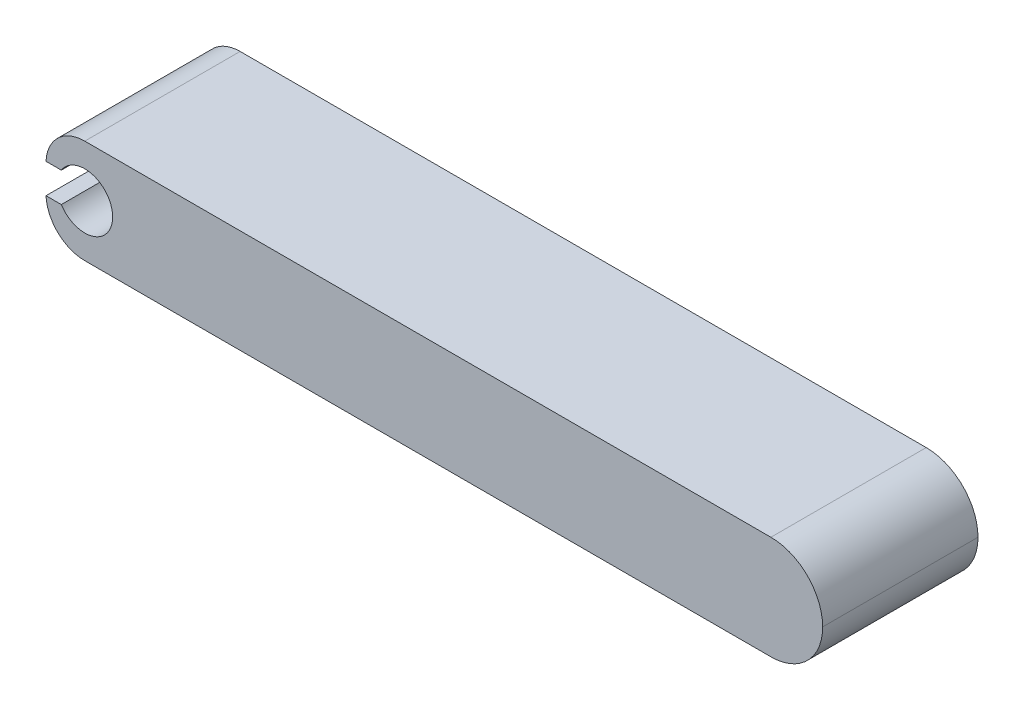
from build123d import *

# Parameters (mm, degrees)
ESQUISSE1_W                  = 60
ESQUISSE1_H                  = 8
BOSS_EXTRU_1_DEPTH           = 12
ENL_V_MAT_EXTRU_1_DEPTH      = 62.708994482
ENL_V_MAT_EXTRU_1_DEPTH_BACK = 62.708994482
ESQUISSE2_R                  = 2.15
ENL_V_MAT_EXTRU_2_DEPTH      = 62.708994482
ENL_V_MAT_EXTRU_2_DEPTH_BACK = 62.708994482
ESQUISSE3_W                  = 2
ESQUISSE3_H                  = 2.3
CONG_1_R                     = 4
CONG_2_R                     = 3


# Some blends are built 0.0001 mm under size
with BuildPart() as part:
    # Esquisse1 → Boss.-Extru.1 (new body)
    with BuildSketch(Plane.XY):
        with Locations((30, 4)):
            Rectangle(ESQUISSE1_W, ESQUISSE1_H)
    extrude(amount=BOSS_EXTRU_1_DEPTH)

    # Esquisse2 → Enlèv. mat.-Extru.1 (cut, two sides: drawn at the far end of the back side and taken through both)
    with BuildSketch(Plane.XY.offset(12).offset(-ENL_V_MAT_EXTRU_1_DEPTH_BACK)):
        with Locations((3, 4)):
            Circle(ESQUISSE2_R)
    extrude(amount=ENL_V_MAT_EXTRU_1_DEPTH + ENL_V_MAT_EXTRU_1_DEPTH_BACK, mode=Mode.SUBTRACT)

    # Esquisse3 → Enlèv. mat.-Extru.2 (cut, two sides: drawn at the far end of the back side and taken through both)
    with BuildSketch(Plane.XY.offset(12).offset(-ENL_V_MAT_EXTRU_2_DEPTH_BACK)):
        with Locations((1, 4)):
            Rectangle(ESQUISSE3_W, ESQUISSE3_H)
    extrude(amount=ENL_V_MAT_EXTRU_2_DEPTH + ENL_V_MAT_EXTRU_2_DEPTH_BACK, mode=Mode.SUBTRACT)

    # Congé1
    cong_1_edges = [part.edges().sort_by_distance(p)[0] for p in [
        (60, 0, 6),
        (60, 8, 6),
    ]]
    fillet(cong_1_edges, radius=CONG_1_R - 0.0001)  # a hair under: the kernel refuses the full size

    # Congé2
    # the kernel refuses this fillet: 3 mm, written as the material it takes off along each edge
    with BuildSketch(Plane(origin=(0, 0, -7.490619133), x_dir=(1, 0, 0), z_dir=(0, 0, 1))) as cong_2_piece_1:
        with BuildLine():
            CenterArc((2.996247653, 3), CONG_2_R, 182.865983983, 87.134016017)
            Line((0, 2.85), (-0.059924953, 2.847))
            ThreePointArc((-0.059924953, 2.847), (-0.06, 1.425), (-0.06, 0))
            Line((-0.06, 0), (0, -0.06))
            Line((0, -0.06), (2.996247653, -0.06))
            Line((2.996247653, -0.06), (2.996247653, 0))
        make_face()
    extrude(amount=26.981238267, mode=Mode.SUBTRACT)
    with BuildSketch(Plane(origin=(0, 8, -7.490619133), x_dir=(1, 0, 0), z_dir=(0, 0, 1))) as cong_2_piece_2:
        with BuildLine():
            CenterArc((2.996247653, -3), CONG_2_R, 90, 87.134016017)
            Line((0, -2.85), (-0.059924953, -2.847))
            ThreePointArc((-0.059924953, -2.847), (-0.06, -1.425), (-0.06, 0))
            Line((-0.06, 0), (0, 0.06))
            Line((0, 0.06), (2.996247653, 0.06))
            Line((2.996247653, 0.06), (2.996247653, 0))
        make_face()
    extrude(amount=26.981238267, mode=Mode.SUBTRACT)


solid = part.part
